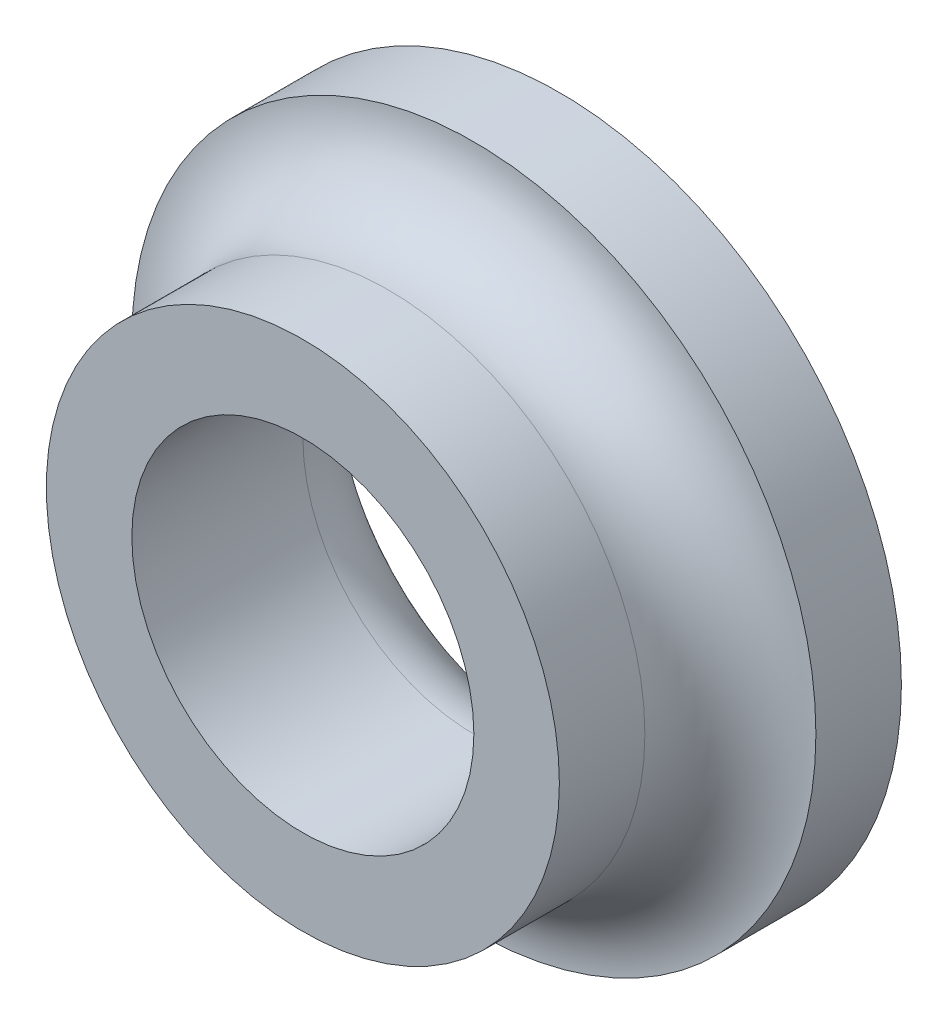
from build123d import *

# Parameters (mm, degrees)
SKETCH1_R           = 4
BOSS_EXTRUDE1_DEPTH = 1
SKETCH2_R           = 3
BOSS_EXTRUDE2_DEPTH = 2
FILLET1_R           = 1
SKETCH3_R           = 2
CUT_EXTRUDE1_DEPTH  = 4
FILLET2_R           = 1


with BuildPart() as part:
    # Sketch1 → Boss-Extrude1 (new body)
    with BuildSketch(Plane.XY):
        Circle(SKETCH1_R)
    extrude(amount=BOSS_EXTRUDE1_DEPTH)

    # Sketch2 → Boss-Extrude2 (add)
    with BuildSketch(Plane.XY.offset(1)):
        Circle(SKETCH2_R)
    extrude(amount=BOSS_EXTRUDE2_DEPTH)

    # Fillet1
    fillet1_edges = [part.edges().sort_by_distance(p)[0] for p in [
        (-3, 0, 1),
    ]]
    fillet(fillet1_edges, radius=FILLET1_R - 0.0001)  # a hair under: the kernel refuses the full size

    # Sketch3 → Cut-Extrude1 (cut)
    with BuildSketch(Plane.XY.offset(3)):
        Circle(SKETCH3_R)
    extrude(amount=-CUT_EXTRUDE1_DEPTH, mode=Mode.SUBTRACT)

    # Fillet2
    fillet2_edges = [part.edges().sort_by_distance(p)[0] for p in [
        (-2, 0, 0),
    ]]
    fillet(fillet2_edges, radius=FILLET2_R)


solid = part.part
